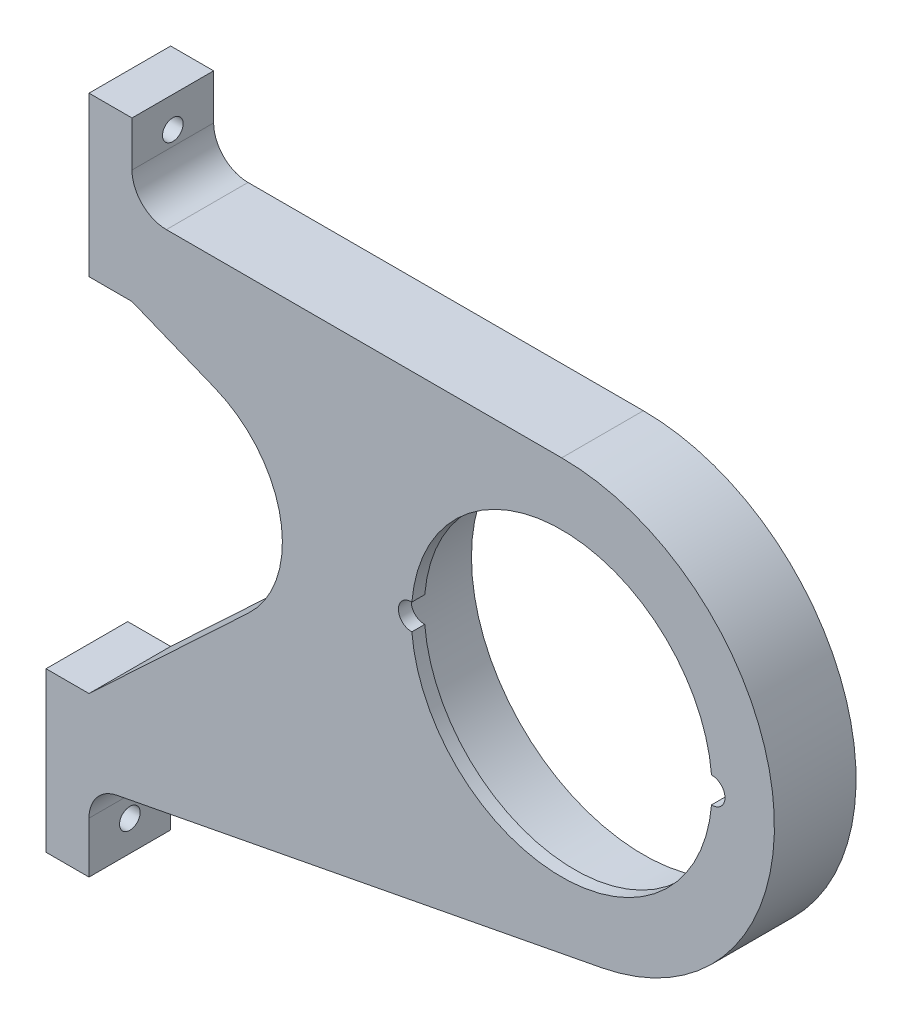
from build123d import *

# Parameters (mm, degrees)
SKETCH1_R           = 50.8
BOSS_EXTRUDE1_DEPTH = 24.13
FILLET1_R           = 10.16
SKETCH2_R           = 3.048
CUT_EXTRUDE1_DEPTH  = 245.919919821
BOSS_EXTRUDE2_START = -3.81
SKETCH3_R           = 50.8
BOSS_EXTRUDE2_DEPTH = 3.81


with BuildPart() as part:
    # Sketch1 → Boss-Extrude1 (new body)
    with BuildSketch(Plane.XY):
        with BuildLine():
            Line((-139.7, 86.36), (-139.7, 39.37))
            Line((-139.7, 39.37), (-127, 39.37))
            Line((-127, 39.37), (-102.410986463, 29.440004367))
            ThreePointArc((-102.410986463, 29.440004367), (-83.089083322, 5.825905948), (-92.590952977, -23.168508311))
            Line((-92.590952977, -23.168508311), (-139.7, -67.31))
            Line((-139.7, -67.31), (-152.4, -67.31))
            Line((-152.4, -67.31), (-152.4, -114.3))
            Line((-152.4, -114.3), (-139.7, -114.3))
            Line((-139.7, -114.3), (-139.7, -90.805))
            Line((-139.7, -90.805), (11.84153274, -61.739665754))
            ThreePointArc((11.84153274, -61.739665754), (62.583034093, 5.947442198), (0, 62.865))
            Line((0, 62.865), (-127, 62.865))
            Line((-127, 62.865), (-127, 86.36))
            Line((-127, 86.36), (-139.7, 86.36))
        make_face()
        Circle(SKETCH1_R, mode=Mode.SUBTRACT)
    extrude(amount=BOSS_EXTRUDE1_DEPTH)

    # Fillet1
    fillet1_edges = [part.edges().sort_by_distance(p)[0] for p in [
        (-139.7, -90.805, 12.065),
        (-127, 62.865, 12.065),
    ]]
    fillet(fillet1_edges, radius=FILLET1_R)

    # Sketch2 → Cut-Extrude1 (cut, through all)
    with BuildSketch(Plane.ZY.offset(152.4)):
        with Locations((12.065, -105.283)):
            Circle(SKETCH2_R)
        with Locations((12.065, 77.343)):
            Circle(SKETCH2_R)
    extrude(amount=-CUT_EXTRUDE1_DEPTH, mode=Mode.SUBTRACT)

    # Sketch3 → Boss-Extrude2 (add)
    with BuildSketch(Plane.XY.offset(24.13).offset(BOSS_EXTRUDE2_START)):
        Circle(SKETCH3_R)
        with BuildLine():
            ThreePointArc((44.286714286, -3.806499412), (0, -44.45), (-44.286714286, -3.806499412))
            ThreePointArc((-44.286714286, -3.806499412), (-48.26, 0), (-44.286714286, 3.806499412))
            ThreePointArc((-44.286714286, 3.806499412), (0, 44.45), (44.286714286, 3.806499412))
            ThreePointArc((44.286714286, 3.806499412), (48.26, 0), (44.286714286, -3.806499412))
        make_face(mode=Mode.SUBTRACT)
    extrude(amount=BOSS_EXTRUDE2_DEPTH)


solid = part.part
